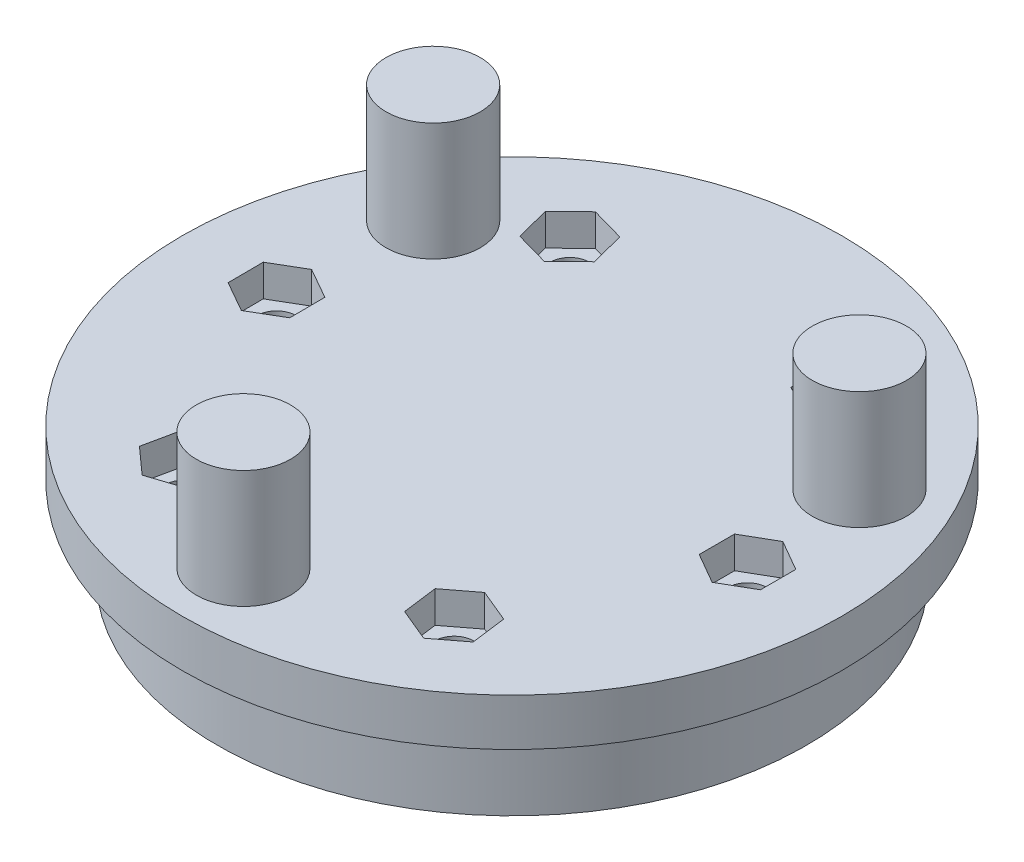
from build123d import *

# Parameters (mm, degrees)
SKETCH3_R               = 28
BOSS_EXTRUDE1_DEPTH     = 4
SKETCH6_R               = 25
BOSS_EXTRUDE4_DEPTH     = 7
SKETCH7_R               = 4
BOSS_EXTRUDE5_DEPTH     = 10
CUT_EXTRUDE1_DEPTH      = 10
CUT_EXTRUDE1_DEPTH_BACK = 43
SKETCH8_R               = 1.65
CUT_EXTRUDE3_DEPTH      = 2.7


with BuildPart() as part:
    # Sketch3 → Boss-Extrude1 (new body)
    with BuildSketch(Plane(origin=(0, 0, 0), x_dir=(1, 0, 0), z_dir=(0, 1, 0))):
        Circle(SKETCH3_R)
    extrude(amount=BOSS_EXTRUDE1_DEPTH)

    # Sketch6 → Boss-Extrude4 (add)
    with BuildSketch(Plane.XZ):
        Circle(SKETCH6_R)
    extrude(amount=BOSS_EXTRUDE4_DEPTH)

    # Sketch7 → Boss-Extrude5 (add)
    with BuildSketch(Plane(origin=(0, 4, 0), x_dir=(1, 0, 0), z_dir=(0, 1, 0))):
        with Locations((-0.954174099, -21.854179847)):
            Circle(SKETCH7_R)
        with Locations((-18.449187877, 11.753428933)):
            Circle(SKETCH7_R)
        with Locations((19.403361976, 10.100750915)):
            Circle(SKETCH7_R)
    extrude(amount=BOSS_EXTRUDE5_DEPTH)

    # Sketch8 → Cut-Extrude1 (cut, two sides: drawn at the far end of the back side and taken through both)
    with BuildSketch(Plane.XZ.offset(-CUT_EXTRUDE1_DEPTH_BACK)):
        with Locations((20, 0)):
            Circle(SKETCH8_R)
        with Locations((-20, 0)):
            Circle(SKETCH8_R)
        with Locations((11.471528727, 16.383040886)):
            Circle(SKETCH8_R)
        with Locations((-11.471528727, -16.383040886)):
            Circle(SKETCH8_R)
        with Locations((11.471528727, -16.383040886)):
            Circle(SKETCH8_R)
        with Locations((-11.471528727, 16.383040886)):
            Circle(SKETCH8_R)
    extrude(amount=CUT_EXTRUDE1_DEPTH + CUT_EXTRUDE1_DEPTH_BACK, mode=Mode.SUBTRACT)

    # Sketch11 → Cut-Extrude3 (cut)
    with BuildSketch(Plane(origin=(0, 4, 0), x_dir=(1, 0, 0), z_dir=(0, 1, 0))):
        Polygon((11.858091258, -19.360271603), (14.243167426, -17.536883273), (13.856604896, -14.559652555), (11.084966196, -13.405810169), (8.699890028, -15.229198499), (9.086452558, -18.206429216), align=None)
        Polygon((-12.091418901, -19.320568674), (-9.237500125, -18.388645418), (-8.617609951, -15.45111763), (-10.851638553, -13.445513098), (-13.705557329, -14.377436353), (-14.325447503, -17.314964141), align=None)
        Polygon((-22.590586111, -1.517299224), (-19.981273382, -3.002162995), (-17.390687271, -1.48486377), (-17.409413889, 1.517299224), (-20.018726618, 3.002162995), (-22.609312729, 1.48486377), align=None)
        Polygon((20, -3.0022214), (22.6, -1.5011107), (22.6, 1.5011107), (20, 3.0022214), (17.4, 1.5011107), (17.4, -1.5011107), align=None)
        Polygon((9.008253879, 14.666762832), (11.726231698, 13.391643264), (14.189506546, 15.107921318), (13.934803575, 18.09931894), (11.216825756, 19.374438507), (8.753550908, 17.658160453), align=None)
        Polygon((-10.729703857, 13.473912288), (-8.581237024, 15.57091577), (-9.323061894, 18.480044367), (-12.213353597, 19.292169483), (-14.36182043, 17.195166002), (-13.61999556, 14.286037405), align=None)
    extrude(amount=-CUT_EXTRUDE3_DEPTH, mode=Mode.SUBTRACT)


solid = part.part
